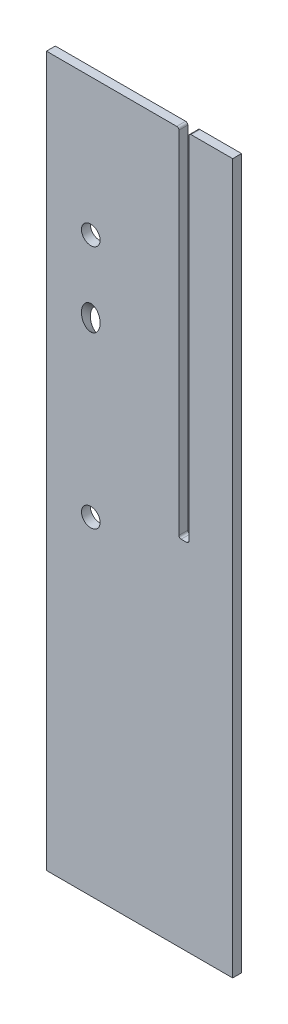
from build123d import *

# Parameters (mm, degrees)
SKETCH2_W               = 266.7
SKETCH2_H               = 1016
BOSS_EXTRUDE1_DEPTH     = 6.35
CUT_EXTRUDE3_DEPTH      = 1025.733402028
CUT_EXTRUDE3_DEPTH_BACK = 1025.733402028
SKETCH5_W               = 12.7
SKETCH5_H               = 508
MOVE_FACE_SLOT_BY       = 0.762
MOVE_FACE_SLOT_2_BY     = 0.762
MOVE_FACE_SLOT_3_BY     = 0.762
FILLET1_R               = 3.175


with BuildPart() as part:
    # Sketch2 → Boss-Extrude1 (new, symmetric)
    with BuildSketch(Plane.XY):
        with Locations((0, 508)):
            Rectangle(SKETCH2_W, SKETCH2_H)
    extrude(amount=BOSS_EXTRUDE1_DEPTH, both=True)

    # Cavity1: read off the stored shape, not the designer's step
    # Cavity1: loft between two sections, ruled curve by curve
    cavity1_from = [
        Edge.make_three_point_arc((-82.55, 819.9, 6.35), (-69.85, 832.6, 6.35), (-57.15, 819.9, 6.35)),
        Edge.make_three_point_arc((-57.15, 819.9, 6.35), (-69.85, 807.2, 6.35), (-82.55, 819.9, 6.35)),
    ]
    cavity1_to = [
        Edge.make_three_point_arc((-82.55, 819.9, -6.35), (-69.85, 832.6, -6.35), (-57.15, 819.9, -6.35)),
        Edge.make_three_point_arc((-57.15, 819.9, -6.35), (-69.85, 807.2, -6.35), (-82.55, 819.9, -6.35)),
    ]
    cavity1 = Solid(Shell([*[Face.make_surface_from_curves(cavity1_from[k], cavity1_to[k]) for k in range(2)], Face(Wire(cavity1_from)), Face(Wire(cavity1_to))]))
    add(cavity1, mode=Mode.SUBTRACT)

    # Cavity1 2: loft between two sections, ruled curve by curve
    cavity1_2_from = [
        Edge.make_three_point_arc((-69.85, 714.991315977, 23.190482806), (-82.55, 724.54904, 14.827474286), (-69.85, 734.106764023, 6.464465766)),
        Edge.make_three_point_arc((-69.85, 734.106764023, 6.464465766), (-57.15, 724.54904, 14.827474286), (-69.85, 714.991315977, 23.190482806)),
    ]
    cavity1_2_to = [
        Edge.make_three_point_arc((-69.85, 689.13960738, -6.354327019), (-82.55, 698.697331403, -14.717335539), (-69.85, 708.255055426, -23.080344059)),
        Edge.make_three_point_arc((-69.85, 708.255055426, -23.080344059), (-57.15, 698.697331403, -14.717335539), (-69.85, 689.13960738, -6.354327019)),
    ]
    cavity1_2 = Solid(Shell([*[Face.make_surface_from_curves(cavity1_2_from[k], cavity1_2_to[k]) for k in range(2)], Face(Wire(cavity1_2_from)), Face(Wire(cavity1_2_to))]))
    add(cavity1_2, mode=Mode.SUBTRACT)

    # Cavity1 3: loft between two sections, ruled curve by curve
    cavity1_3_from = [
        Edge.make_three_point_arc((-82.55, 469.9, 6.35), (-69.85, 482.6, 6.35), (-57.15, 469.9, 6.35)),
        Edge.make_three_point_arc((-57.15, 469.9, 6.35), (-69.85, 457.2, 6.35), (-82.55, 469.9, 6.35)),
    ]
    cavity1_3_to = [
        Edge.make_three_point_arc((-82.55, 469.9, -6.35), (-69.85, 482.6, -6.35), (-57.15, 469.9, -6.35)),
        Edge.make_three_point_arc((-57.15, 469.9, -6.35), (-69.85, 457.2, -6.35), (-82.55, 469.9, -6.35)),
    ]
    cavity1_3 = Solid(Shell([*[Face.make_surface_from_curves(cavity1_3_from[k], cavity1_3_to[k]) for k in range(2)], Face(Wire(cavity1_3_from)), Face(Wire(cavity1_3_to))]))
    add(cavity1_3, mode=Mode.SUBTRACT)

    # Sketch5 → Cut-Extrude3 (cut, two sides: drawn at the far end of the back side and taken through both)
    with BuildSketch(Plane.XY.offset(-CUT_EXTRUDE3_DEPTH_BACK)):
        with Locations((63.5, 762)):
            Rectangle(SKETCH5_W, SKETCH5_H)
    extrude(amount=CUT_EXTRUDE3_DEPTH + CUT_EXTRUDE3_DEPTH_BACK, mode=Mode.SUBTRACT)

    # Move Face slot: a face moved inward by 0.762
    extrude(part.faces().sort_by_distance((63.5, 508, 0))[0], amount=MOVE_FACE_SLOT_BY, dir=(0, -1, 0), mode=Mode.SUBTRACT)

    # Move Face slot 2: a face moved inward by 0.762
    extrude(part.faces().sort_by_distance((69.85, 762, 0))[0], amount=MOVE_FACE_SLOT_2_BY, dir=(1, 0, 0), mode=Mode.SUBTRACT)

    # Move Face slot 3: a face moved inward by 0.762
    extrude(part.faces().sort_by_distance((57.15, 762, 0))[0], amount=MOVE_FACE_SLOT_3_BY, dir=(-1, 0, 0), mode=Mode.SUBTRACT)

    # Fillet1
    fillet1_edges = [part.edges().sort_by_distance(p)[0] for p in [
        (70.612, 1016, 0),
        (70.612, 507.238, 0),
        (56.388, 507.238, 0),
        (56.388, 1016, 0),
    ]]
    fillet(fillet1_edges, radius=FILLET1_R)

    # Move Face hole: read off the stored shape, not the designer's step
    # Move Face hole: loft between two sections, ruled curve by curve
    move_face_hole_from = [
        Edge.make_three_point_arc((-83.185, 819.9, 6.35), (-69.85, 833.235, 6.35), (-56.515, 819.9, 6.35)),
        Edge.make_three_point_arc((-56.515, 819.9, 6.35), (-69.85, 806.565, 6.35), (-83.185, 819.9, 6.35)),
    ]
    move_face_hole_to = [
        Edge.make_three_point_arc((-83.185, 819.9, -6.35), (-69.85, 833.235, -6.35), (-56.515, 819.9, -6.35)),
        Edge.make_three_point_arc((-56.515, 819.9, -6.35), (-69.85, 806.565, -6.35), (-83.185, 819.9, -6.35)),
    ]
    move_face_hole = Solid(Shell([*[Face.make_surface_from_curves(move_face_hole_from[k], move_face_hole_to[k]) for k in range(2)], Face(Wire(move_face_hole_from)), Face(Wire(move_face_hole_to))]))
    add(move_face_hole, mode=Mode.SUBTRACT)

    # Move Face hole 2: loft between two sections, ruled curve by curve
    move_face_hole_2_from = [
        Edge.make_three_point_arc((-69.85, 714.884319276, 24.032506946), (-83.185, 724.9199295, 15.251348), (-69.85, 734.955539724, 6.470189054)),
        Edge.make_three_point_arc((-69.85, 734.955539724, 6.470189054), (-56.515, 724.9199295, 15.251348), (-69.85, 714.884319276, 24.032506946)),
    ]
    move_face_hole_2_to = [
        Edge.make_three_point_arc((-69.85, 688.295650249, -6.35454337), (-83.185, 698.331260473, -15.135702316), (-69.85, 708.366870697, -23.916861262)),
        Edge.make_three_point_arc((-69.85, 708.366870697, -23.916861262), (-56.515, 698.331260473, -15.135702316), (-69.85, 688.295650249, -6.35454337)),
    ]
    move_face_hole_2 = Solid(Shell([*[Face.make_surface_from_curves(move_face_hole_2_from[k], move_face_hole_2_to[k]) for k in range(2)], Face(Wire(move_face_hole_2_from)), Face(Wire(move_face_hole_2_to))]))
    add(move_face_hole_2, mode=Mode.SUBTRACT)

    # Move Face hole 3: loft between two sections, ruled curve by curve
    move_face_hole_3_from = [
        Edge.make_three_point_arc((-83.185, 469.9, 6.35), (-69.85, 483.235, 6.35), (-56.515, 469.9, 6.35)),
        Edge.make_three_point_arc((-56.515, 469.9, 6.35), (-69.85, 456.565, 6.35), (-83.185, 469.9, 6.35)),
    ]
    move_face_hole_3_to = [
        Edge.make_three_point_arc((-83.185, 469.9, -6.35), (-69.85, 483.235, -6.35), (-56.515, 469.9, -6.35)),
        Edge.make_three_point_arc((-56.515, 469.9, -6.35), (-69.85, 456.565, -6.35), (-83.185, 469.9, -6.35)),
    ]
    move_face_hole_3 = Solid(Shell([*[Face.make_surface_from_curves(move_face_hole_3_from[k], move_face_hole_3_to[k]) for k in range(2)], Face(Wire(move_face_hole_3_from)), Face(Wire(move_face_hole_3_to))]))
    add(move_face_hole_3, mode=Mode.SUBTRACT)


solid = part.part
